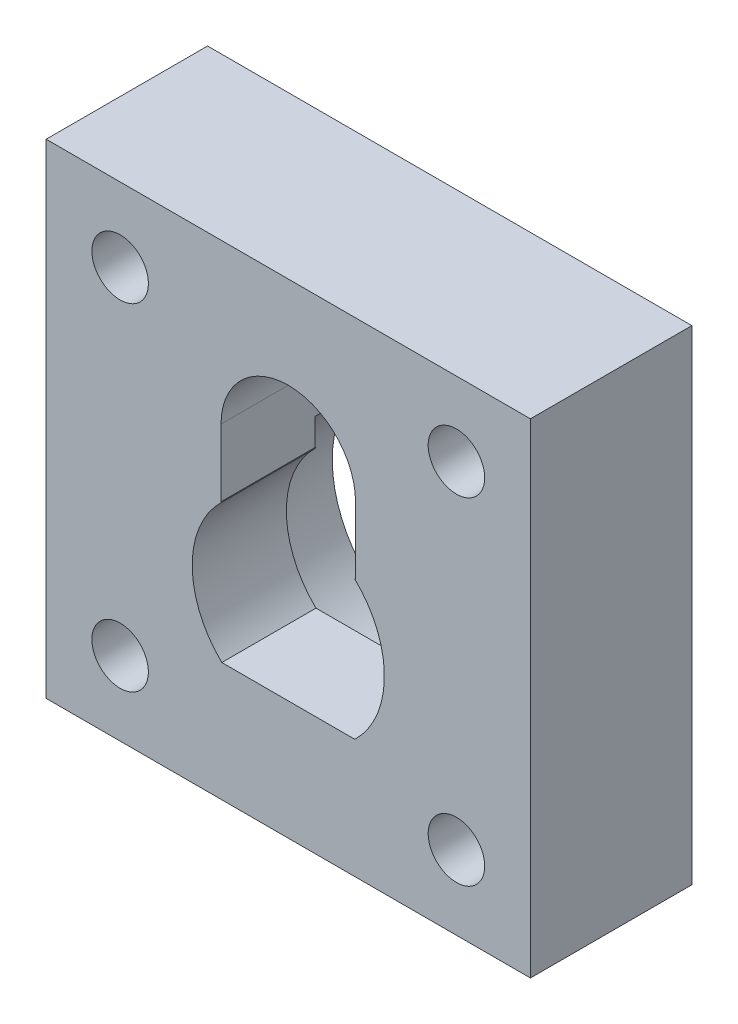
from build123d import *

# Parameters (mm, degrees)
SKETCH1_W             = 36
SKETCH1_H             = 36
BOSS_EXTRUDE1_DEPTH   = 12
SKETCH2_R             = 8.73125
CUT_EXTRUDE1_DEPTH    = 5
CUT_EXTRUDE2_REACH    = 28.401
CUT_EXTRUDE3_REACH    = 30.142
M5X0_8_TAPPED_HOLE1_D = 4.2


with BuildPart() as part:
    # Sketch1 → Boss-Extrude1 (new body)
    with BuildSketch(Plane.XY):
        Rectangle(SKETCH1_W, SKETCH1_H)
    extrude(amount=BOSS_EXTRUDE1_DEPTH)

    # Sketch2 → Cut-Extrude1 (cut)
    with BuildSketch(Plane(origin=(0, 0, 0), x_dir=(-1, 0, 0), z_dir=(0, 0, -1))):
        with Locations((0, -4)):
            Circle(SKETCH2_R)
    extrude(amount=-CUT_EXTRUDE1_DEPTH, mode=Mode.SUBTRACT)

    # Sketch3 → Cut-Extrude2 (cut, up to next)
    with BuildSketch(Plane(origin=(0, 0, 5), x_dir=(-1, 0, 0), z_dir=(0, 0, -1)), mode=Mode.PRIVATE) as cut_extrude2_sk1:
        with BuildLine():
            Line((-4.941053903, 1.159375), (4.941053903, 1.159375))
            ThreePointArc((4.941053903, 1.159375), (7.14375, -4), (4.941053903, -9.159375))
            Line((4.941053903, -9.159375), (-4.941053903, -9.159375))
            ThreePointArc((-4.941053903, -9.159375), (-7.14375, -4), (-4.941053903, 1.159375))
        make_face()
    cut_extrude2_tool1 = extrude(cut_extrude2_sk1.sketch, amount=-CUT_EXTRUDE2_REACH, mode=Mode.PRIVATE) & part.part
    add(cut_extrude2_tool1.solids().sort_by_distance((0, -4, 5))[0], mode=Mode.SUBTRACT)

    # Sketch4 → Cut-Extrude3 (cut, up to next)
    with BuildSketch(Plane(origin=(0, 0, 0), x_dir=(-1, 0, 0), z_dir=(0, 0, -1)), mode=Mode.PRIVATE) as cut_extrude3_sk1:
        with BuildLine():
            Line((-5, 6.159375), (-5, 1.159375))
            Line((-5, 1.159375), (5, 1.159375))
            Line((5, 1.159375), (5, 6.159375))
            ThreePointArc((5, 6.159375), (0, 11.159375), (-5, 6.159375))
        make_face()
    cut_extrude3_tool1 = extrude(cut_extrude3_sk1.sketch, amount=-CUT_EXTRUDE3_REACH, mode=Mode.PRIVATE) & part.part
    add(cut_extrude3_tool1.solids().sort_by_distance((0, 5.692626, 0))[0], mode=Mode.SUBTRACT)

    # M5x0.8 Tapped Hole1 (through all)
    with Locations(Plane.XY.offset(12)):
        with Locations((-12.5, -12.5), (12.5, -12.5), (12.5, 12.5), (-12.5, 12.5)):
            Hole(M5X0_8_TAPPED_HOLE1_D / 2)


solid = part.part
